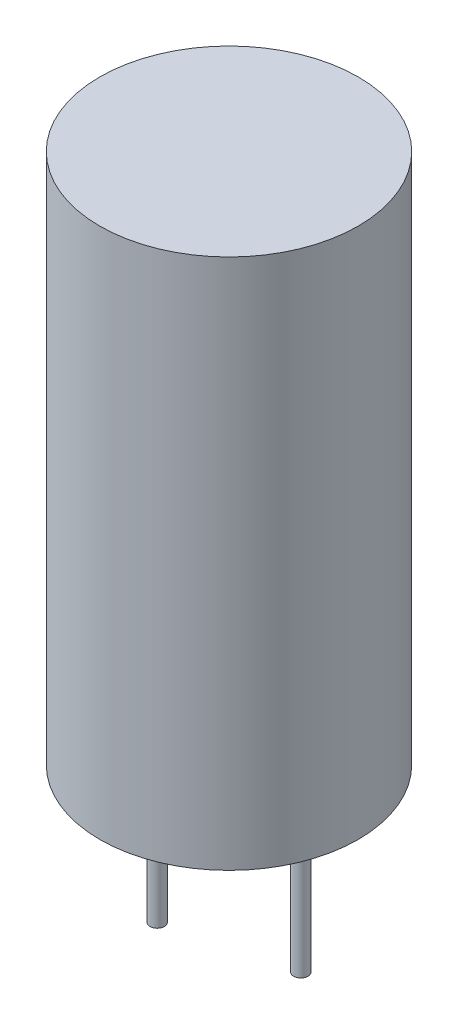
from build123d import *

# Parameters (mm, degrees)
SKETCH_1_R      = 9
EXTRUDE_1_DEPTH = 37
SKETCH_2_R      = 0.5
EXTRUDE_2_DEPTH = 12
SKETCH_3_R      = 0.5
EXTRUDE_3_DEPTH = 10


with BuildPart() as part:
    # 草图1 → 拉伸1 (new body)
    with BuildSketch(Plane(origin=(0, 0, 0), x_dir=(1, 0, 0), z_dir=(0, 1, 0))):
        Circle(SKETCH_1_R)
    extrude(amount=EXTRUDE_1_DEPTH)

    # 草图2 → 拉伸2 (add)
    with BuildSketch(Plane.XZ):
        with Locations((-5, 0)):
            Circle(SKETCH_2_R)
    extrude(amount=EXTRUDE_2_DEPTH)

    # 草图3 → 拉伸3 (add)
    with BuildSketch(Plane.XZ):
        with Locations((5, 0)):
            Circle(SKETCH_3_R)
    extrude(amount=EXTRUDE_3_DEPTH)


solid = part.part
